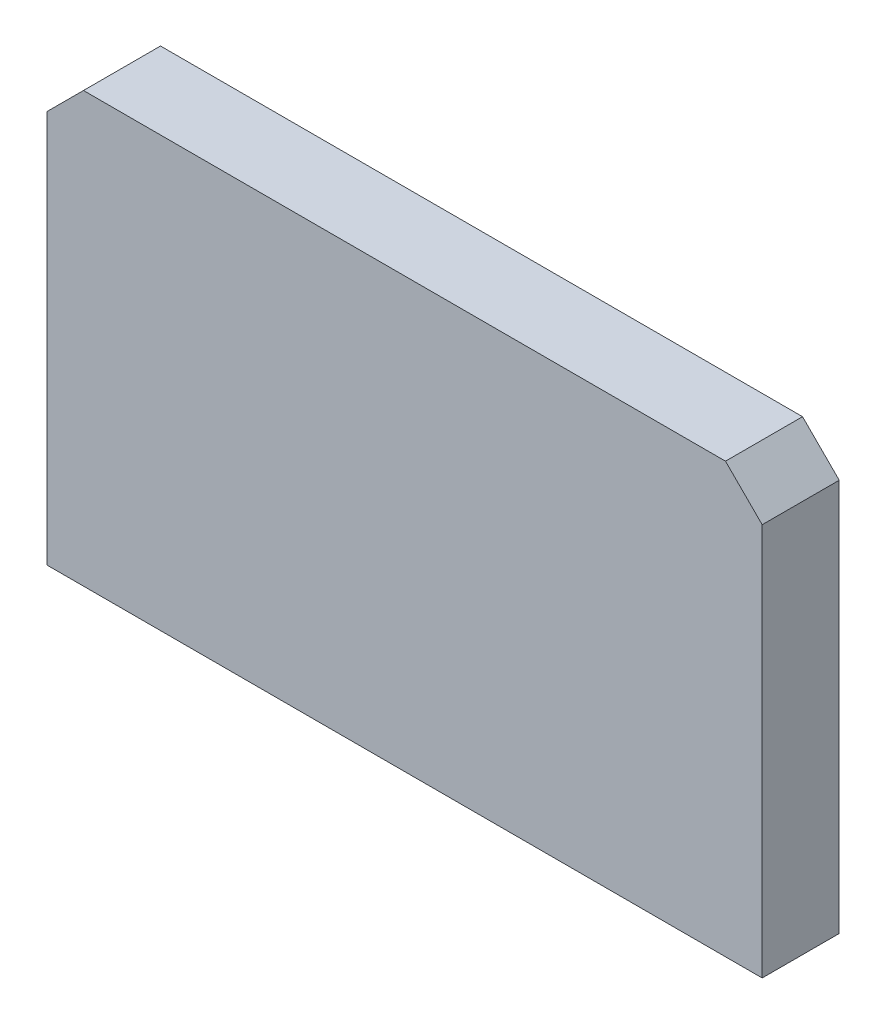
from build123d import *

# Parameters (mm, degrees)
BUTTON_1_DEPTH            = 2.1
SKETCH_1_R                = 0.925
EXTRUDE_1_DEPTH           = 2
EXTRUDE_1_DRAFT           = 2
EXTRUDE_1_PROFILE_2_DEPTH = 2
EXTRUDE_1_PROFILE_2_DRAFT = 2
CHAMFER_1_SIZE            = 1
CHAMFER_2_SIZE            = 1


# Read off the part's stored shape, not the designer's step: 基体零件-button-1
with BuildPart() as part:
    # 基体零件-button-1 outline → 基体零件-button-1 (new body)
    with BuildSketch(Plane.XY):
        Polygon((-62.765330564, -7.006843897), (-62.765330564, -18.706843897), (-61.765330564, -19.706843897), (-44.265330564, -19.706843897), (-43.265330564, -18.706843897), (-43.265330564, -7.006843897), align=None)
    extrude(amount=BUTTON_1_DEPTH)


with BuildPart() as extrude_1_tool:
    # 草图1 → 凸台-拉伸1 (with draft: the straight prism first)
    with BuildSketch(Plane(origin=(0, 0, 0), x_dir=(-1, 0, 0), z_dir=(0, 0, -1))):
        with Locations((53.015330564, -11.706843897)):
            Circle(SKETCH_1_R)
    extrude(amount=EXTRUDE_1_DEPTH)
    # 凸台-拉伸1: the draft: its side faces are tilted about the plane it starts from
    extrude_1_sides = [extrude_1_tool.faces().sort_by_distance(p)[0] for p in [
        (-52.090330564, -11.706843897, -1),
    ]]
    draft(extrude_1_sides, Plane(origin=(0, 0, 0), x_dir=(-1, 0, 0), z_dir=(0, 0, -1)), EXTRUDE_1_DRAFT)


with BuildPart() as part_1:
    add(part.part)

    # 凸台-拉伸1: add extrude_1_tool
    add(extrude_1_tool.part)


with BuildPart() as extrude_1_profile_2_tool:
    # 草图1 → 凸台-拉伸1 profile 2 (with draft: the straight prism first)
    with BuildSketch(Plane(origin=(0, 0, 0), x_dir=(-1, 0, 0), z_dir=(0, 0, -1))):
        with Locations((53.015330564, -15.706843897)):
            Circle(SKETCH_1_R)
    extrude(amount=EXTRUDE_1_PROFILE_2_DEPTH)
    # 凸台-拉伸1 profile 2: the draft: its side faces are tilted about the plane it starts from
    extrude_1_profile_2_sides = [extrude_1_profile_2_tool.faces().sort_by_distance(p)[0] for p in [
        (-52.090330564, -15.706843897, -1),
    ]]
    draft(extrude_1_profile_2_sides, Plane(origin=(0, 0, 0), x_dir=(-1, 0, 0), z_dir=(0, 0, -1)), EXTRUDE_1_PROFILE_2_DRAFT)


with BuildPart() as part_2:
    add(part_1.part)

    # 凸台-拉伸1 profile 2: add extrude_1_profile_2_tool
    add(extrude_1_profile_2_tool.part)

    # 倒角1
    chamfer_1_edges = [part_2.edges().sort_by_distance(p)[0] for p in [
        (-53.015330564, -19.706843897, 2.1),
    ]]
    chamfer(chamfer_1_edges, length=CHAMFER_1_SIZE)

    # 倒角2
    chamfer_2_edges = [part_2.edges().sort_by_distance(p)[0] for p in [
        (-62.765330564, -7.006843897, 1.05),
        (-43.265330564, -7.006843897, 1.05),
    ]]
    chamfer(chamfer_2_edges, length=CHAMFER_2_SIZE)


solid = part_2.part
